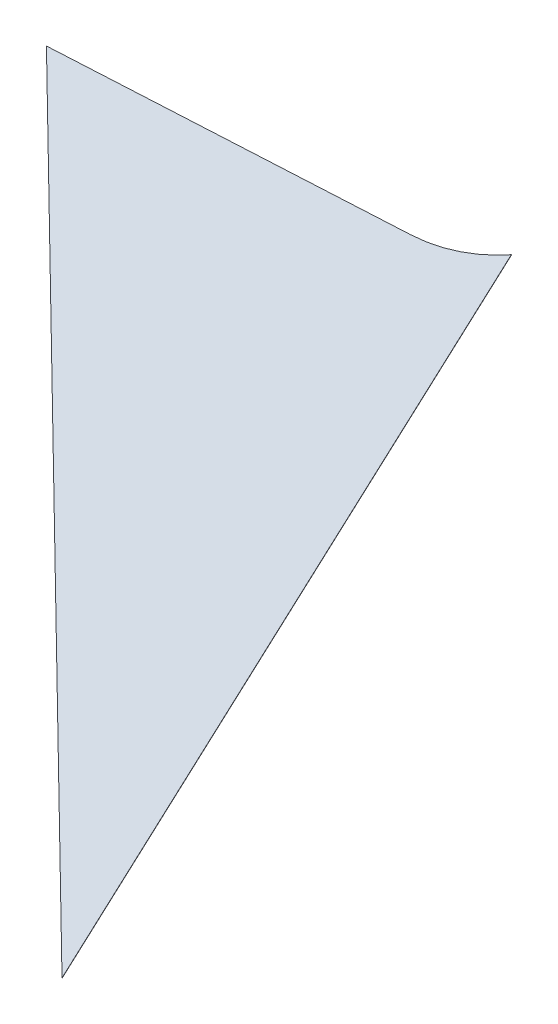
from build123d import *

# Parameters (mm, degrees)
BOSS_EXTRUDE1_DEPTH = 0.0762


with BuildPart() as part:
    # Sketch2 → Boss-Extrude1 (new, symmetric)
    with BuildSketch(Plane(origin=(-105.71970528, -348.553814309, -780.528914654), x_dir=(0.998460453708484, 0.05529862010587767, 0.004334165967541288), z_dir=(0.04555481308108404, -0.7729264674271299, -0.632858147577927))):
        with BuildLine():
            Line((40.522667634, 35.779473673), (198.132774811, 35.779473673))
            add(Edge.make_bspline(
                [(235, 27.024746031), (217.605965138, 35.779473673), (198.132774811, 35.779473673)],
                knots=[1.104478507, 1.104478507, 1.104478507, 1.570796327, 1.570796327, 1.570796327], degree=2, weights=[1, 0.972941378, 1]))
            Line((235, 27.024746031), (235, 287.108094093))
            Line((235, 287.108094093), (40.522667634, 35.779473673))
        make_face()
    extrude(amount=BOSS_EXTRUDE1_DEPTH, both=True)


solid = part.part
